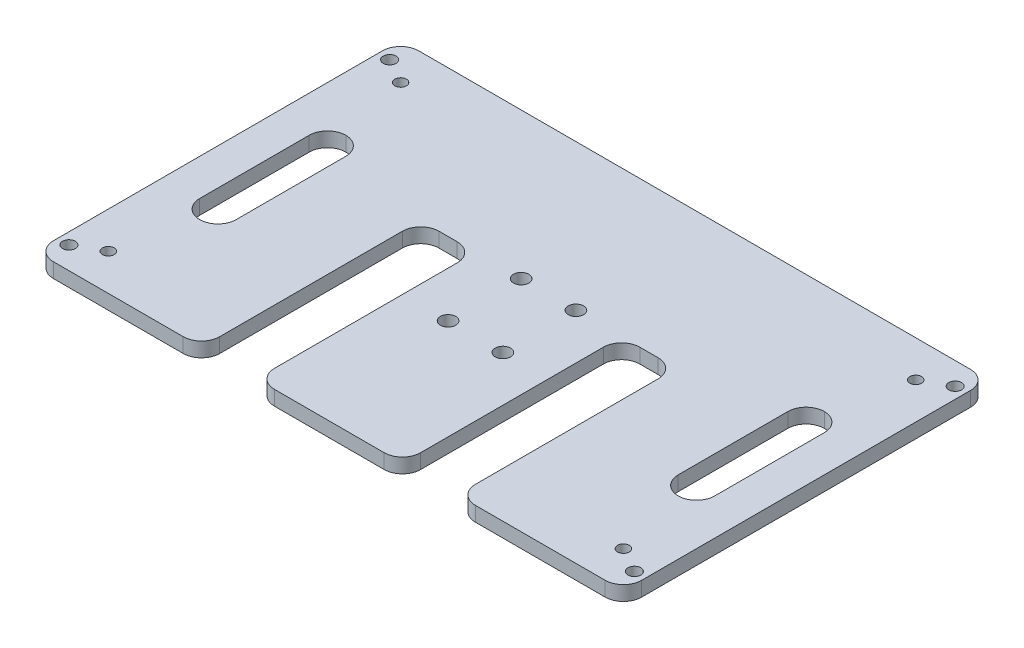
from build123d import *

# Parameters (mm, degrees)
SKETCH1_W               = 161
SKETCH1_H               = 100
BOSS_EXTRUDE1_DEPTH     = 4
SKETCH2_R               = 1.75
CUT_EXTRUDE1_DEPTH      = 95.84856351
MIRROR2_COPY_1_SKETCH_R = 1.75
MIRROR2_COPY_1_DEPTH    = 95.84856351
SKETCH3_W               = 15
SKETCH3_H               = 60
CUT_EXTRUDE2_DEPTH      = 95.84856351
SKETCH4_R               = 1.6
CUT_EXTRUDE3_DEPTH      = 95.84856351
MIRROR5_COPY_1_SKETCH_R = 1.6
MIRROR5_COPY_1_DEPTH    = 95.84856351
SKETCH5_R               = 2.1
CUT_EXTRUDE4_DEPTH      = 95.84856351
SKETCH6_W               = 10
SKETCH6_H               = 40
CUT_EXTRUDE5_DEPTH      = 95.84856351
FILLET1_R               = 5


with BuildPart() as part:
    # Sketch1 → Boss-Extrude1 (new body)
    with BuildSketch(Plane(origin=(0, 0, 0), x_dir=(1, 0, 0), z_dir=(0, 1, 0))):
        Rectangle(SKETCH1_W, SKETCH1_H)
    extrude(amount=BOSS_EXTRUDE1_DEPTH)

    # Sketch2 → Cut-Extrude1 (cut, through all)
    with BuildSketch(Plane(origin=(0, 4, 0), x_dir=(1, 0, 0), z_dir=(0, 1, 0))):
        with Locations(Location((77.4, -43.9, 0), (0, 0, 270))):
            Circle(SKETCH2_R)
    cut_extrude1 = extrude(amount=-CUT_EXTRUDE1_DEPTH, mode=Mode.SUBTRACT)

    # Mirror1: Cut-Extrude1 across plane
    add(cut_extrude1.mirror(Plane.XY), mode=Mode.SUBTRACT)

    # Mirror2: Cut-Extrude1 across plane
    add(cut_extrude1.mirror(Plane(origin=(0, 0, 0), x_dir=(0, 0, 1), z_dir=(1, 0, 0))), mode=Mode.SUBTRACT)

    # Mirror2 copy 1 sketch → Mirror2 copy 1 (cut, through all)
    with BuildSketch(Plane(origin=(0, 4, 0), x_dir=(-1, 0, 0), z_dir=(0, 1, 0))):
        with Locations(Location((77.4, -43.9, 0), (0, 0, 270))):
            Circle(MIRROR2_COPY_1_SKETCH_R)
    extrude(amount=-MIRROR2_COPY_1_DEPTH, mode=Mode.SUBTRACT)

    # Sketch3 → Cut-Extrude2 (cut, through all)
    with BuildSketch(Plane(origin=(0, 4, 0), x_dir=(1, 0, 0), z_dir=(0, 1, 0))):
        with Locations((-27.5, -20)):
            Rectangle(SKETCH3_W, SKETCH3_H)
    cut_extrude2 = extrude(amount=-CUT_EXTRUDE2_DEPTH, mode=Mode.SUBTRACT)

    # Mirror3: Cut-Extrude2 across plane
    add(cut_extrude2.mirror(Plane(origin=(0, 0, 0), x_dir=(0, 0, 1), z_dir=(1, 0, 0))), mode=Mode.SUBTRACT)

    # Sketch4 → Cut-Extrude3 (cut, through all)
    with BuildSketch(Plane(origin=(0, 4, 0), x_dir=(1, 0, 0), z_dir=(0, 1, 0))):
        with Locations(Location((-70.5, 40, 0), (0, 0, 270))):
            Circle(SKETCH4_R)
    cut_extrude3 = extrude(amount=-CUT_EXTRUDE3_DEPTH, mode=Mode.SUBTRACT)

    # Mirror4: Cut-Extrude3 across plane
    add(cut_extrude3.mirror(Plane.XY), mode=Mode.SUBTRACT)

    # Mirror5: Cut-Extrude3 across plane
    add(cut_extrude3.mirror(Plane(origin=(0, 0, 0), x_dir=(0, 0, 1), z_dir=(1, 0, 0))), mode=Mode.SUBTRACT)

    # Mirror5 copy 1 sketch → Mirror5 copy 1 (cut, through all)
    with BuildSketch(Plane(origin=(0, 4, 0), x_dir=(-1, 0, 0), z_dir=(0, 1, 0))):
        with Locations(Location((-70.5, 40, 0), (0, 0, 270))):
            Circle(MIRROR5_COPY_1_SKETCH_R)
    extrude(amount=-MIRROR5_COPY_1_DEPTH, mode=Mode.SUBTRACT)

    # Sketch5 → Cut-Extrude4 (cut, through all)
    with BuildSketch(Plane(origin=(0, 4, 0), x_dir=(1, 0, 0), z_dir=(0, 1, 0))):
        with Locations(Location((-7.5, 10, 0), (0, 0, 270))):
            Circle(SKETCH5_R)
        with Locations(Location((7.5, 10, 0), (0, 0, 270))):
            Circle(SKETCH5_R)
        with Locations(Location((7.5, -10, 0), (0, 0, 270))):
            Circle(SKETCH5_R)
        with Locations(Location((-7.5, -10, 0), (0, 0, 270))):
            Circle(SKETCH5_R)
    extrude(amount=-CUT_EXTRUDE4_DEPTH, mode=Mode.SUBTRACT)

    # Sketch6 → Cut-Extrude5 (cut, through all)
    with BuildSketch(Plane(origin=(0, 4, 0), x_dir=(1, 0, 0), z_dir=(0, 1, 0))):
        with Locations((-65.5, 0)):
            Rectangle(SKETCH6_W, SKETCH6_H)
    cut_extrude5 = extrude(amount=-CUT_EXTRUDE5_DEPTH, mode=Mode.SUBTRACT)

    # Mirror6: Cut-Extrude5 across plane
    add(cut_extrude5.mirror(Plane(origin=(0, 0, 0), x_dir=(0, 0, 1), z_dir=(1, 0, 0))), mode=Mode.SUBTRACT)

    # Fillet1
    fillet1_edges = [part.edges().sort_by_distance(p)[0] for p in [
        (-20, 2, -10),
        (-35, 2, -10),
        (20, 2, -10),
        (35, 2, -10),
        (20, 2, 50),
        (35, 2, 50),
        (-20, 2, 50),
        (-35, 2, 50),
        (-80.5, 2, 50),
        (-80.5, 2, -50),
        (80.5, 2, -50),
        (80.5, 2, 50),
        (60.5, 2, -20),
        (70.5, 2, -20),
        (70.5, 2, 20),
        (60.5, 2, 20),
        (-70.5, 2, -20),
        (-60.5, 2, -20),
        (-60.5, 2, 20),
        (-70.5, 2, 20),
    ]]
    fillet(fillet1_edges, radius=FILLET1_R - 0.0001)  # a hair under: the kernel refuses the full size


solid = part.part
